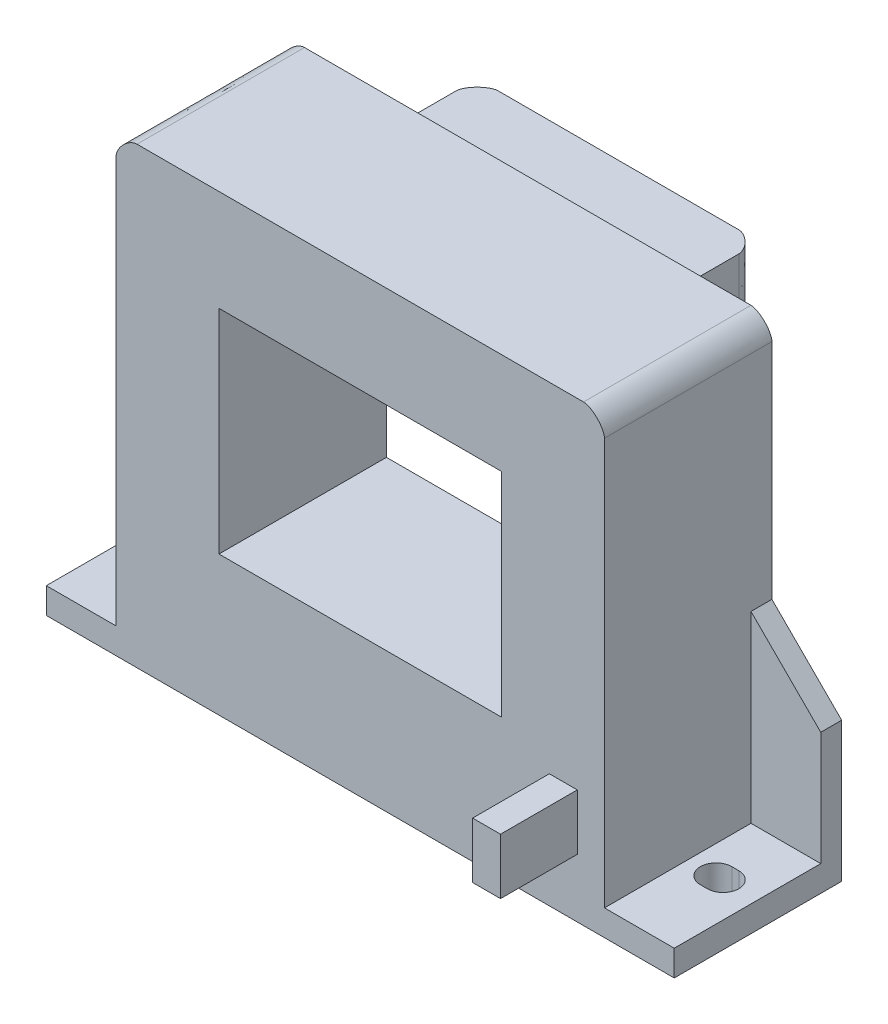
from build123d import *

# Parameters (mm, degrees)
SKETCH1_W           = 70
SKETCH1_H           = 65
BOSS_EXTRUDE1_DEPTH = 12
BOSS_EXTRUDE2_START = 10
BOSS_EXTRUDE2_DEPTH = 90
BOSS_EXTRUDE3_DEPTH = 3
SKETCH4_W           = 40.5
SKETCH4_H           = 10
BOSS_EXTRUDE4_DEPTH = 13
SKETCH5_W           = 40.5
SKETCH5_H           = 30.5
CUT_EXTRUDE1_DEPTH  = 24
SKETCH6_W           = 4
SKETCH6_H           = 8
BOSS_EXTRUDE5_DEPTH = 11
FILLET1_SIZE        = 3
SKETCH7_R           = 2.25
CUT_EXTRUDE2_DEPTH  = 3.7


with BuildPart() as part:
    # Sketch1 → Boss-Extrude1 (new, symmetric)
    with BuildSketch(Plane.XY):
        with Locations((0, 32.5)):
            Rectangle(SKETCH1_W, SKETCH1_H)
    extrude(amount=BOSS_EXTRUDE1_DEPTH, both=True)

    # Sketch2 → Boss-Extrude2 (add)
    with BuildSketch(Plane(origin=(35, 0, 0), x_dir=(0, 0, -1), z_dir=(1, 0, 0)).offset(BOSS_EXTRUDE2_START)):
        Polygon((12, 20), (12, 0), (-12, 0), (-12, 3.7), (9, 3.7), (9, 20), align=None)
    extrude(amount=-BOSS_EXTRUDE2_DEPTH)

    # Sketch3 → Boss-Extrude3 (add)
    with BuildSketch(Plane(origin=(0, 0, -12), x_dir=(-1, 0, 0), z_dir=(0, 0, -1))):
        Polygon((-45, 20), (-35, 20), (-35, 30), align=None)
        Polygon((35, 30), (45, 20), (35, 20), align=None)
    extrude(amount=-BOSS_EXTRUDE3_DEPTH)

    # Sketch4 → Boss-Extrude4 (add)
    with BuildSketch(Plane.XY.offset(-12)):
        with Locations((0, 55.5)):
            Rectangle(SKETCH4_W, SKETCH4_H)
    extrude(amount=-BOSS_EXTRUDE4_DEPTH)

    # Sketch5 → Cut-Extrude1 (cut)
    with BuildSketch(Plane.XY.offset(12)):
        with Locations((0, 35.25)):
            Rectangle(SKETCH5_W, SKETCH5_H)
    extrude(amount=-CUT_EXTRUDE1_DEPTH, mode=Mode.SUBTRACT)

    # Sketch6 → Boss-Extrude5 (add)
    with BuildSketch(Plane.XY.offset(12)):
        with Locations((29.1, 12.4)):
            Rectangle(SKETCH6_W, SKETCH6_H)
    extrude(amount=BOSS_EXTRUDE5_DEPTH)

    # Fillet1
    # a fillet whose section is not a circle: 3 mm, written as the material it takes off along each edge
    with BuildSketch(Plane(origin=(-35, 65, 19.5), x_dir=(0, -1, 0), z_dir=(0, 0, -1)), Plane(origin=(35, 65, -19.5), x_dir=(0, -1, 0), z_dir=(0, 0, 1))) as fillet1_piece_1:
        with BuildLine():
            Bezier((FILLET1_SIZE, 0), (0, 0), (0, -FILLET1_SIZE), weights=[1, 0.428571429, 1])
            Line((0, -FILLET1_SIZE), (0, 0))
            Line((0, 0), (FILLET1_SIZE, 0))
        make_face()
    extrude(amount=39, mode=Mode.SUBTRACT)
    with BuildSketch(Plane(origin=(-20.25, 43, -25), x_dir=(0, 0, 1), z_dir=(0, 1, 0)), Plane(origin=(20.25, 68, -25), x_dir=(0, 0, 1), z_dir=(0, -1, 0))) as fillet1_piece_2:
        with BuildLine():
            Bezier((FILLET1_SIZE, 0), (0, 0), (0, FILLET1_SIZE), weights=[1, 0.428571429, 1])
            Line((0, FILLET1_SIZE), (0, 0))
            Line((0, 0), (FILLET1_SIZE, 0))
        make_face()
    extrude(amount=25, mode=Mode.SUBTRACT)

    # Sketch7 → Cut-Extrude2 (cut)
    with BuildSketch(Plane(origin=(0, 3.7, 0), x_dir=(1, 0, 0), z_dir=(0, 1, 0))):
        with Locations(Location((-39, 0, 0), (0, 0, 270))):
            Circle(SKETCH7_R)
        with BuildLine():
            Line((39, 2.25), (40, 2.25))
            ThreePointArc((40, 2.25), (42.25, 0), (40, -2.25))
            Line((40, -2.25), (39, -2.25))
            ThreePointArc((39, -2.25), (36.75, 0), (39, 2.25))
        make_face()
    extrude(amount=-CUT_EXTRUDE2_DEPTH, mode=Mode.SUBTRACT)


solid = part.part
